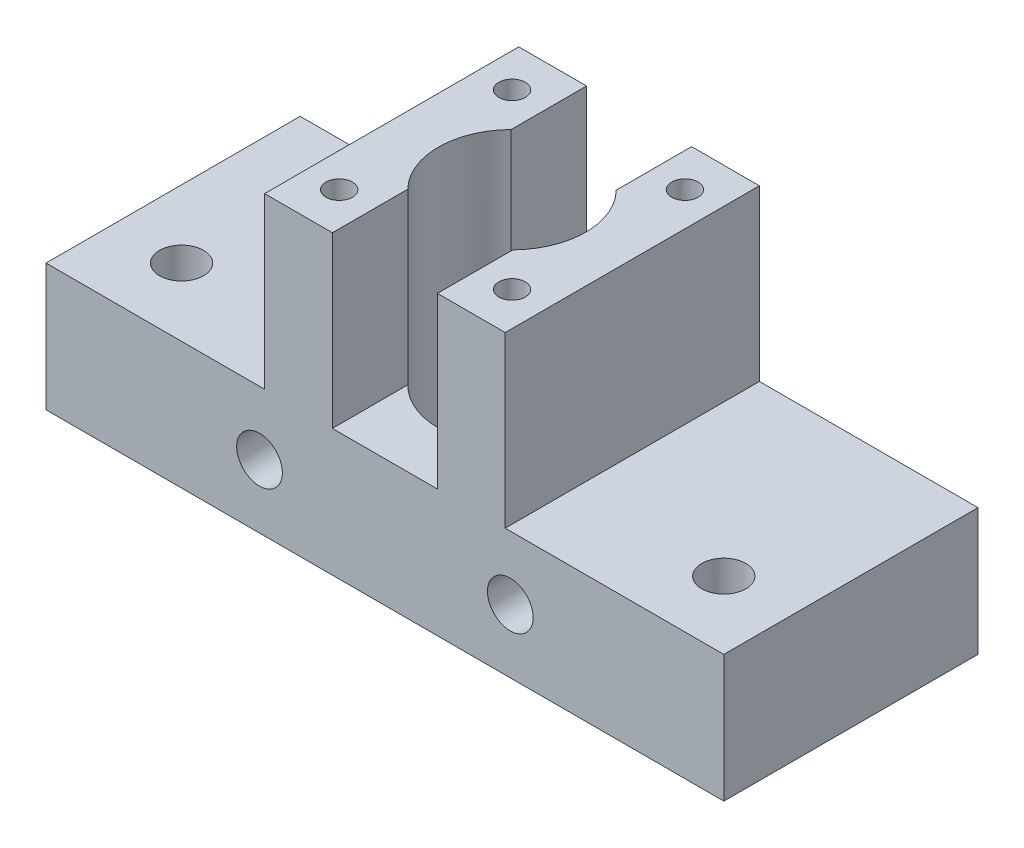
from build123d import *

# Parameters (mm, degrees)
SKETCH3_W               = 101.6
SKETCH3_H               = 38.1
BOSS_EXTRUDE2_DEPTH     = 19.05
BOSS_EXTRUDE4_START     = 24.868285686
BOSS_EXTRUDE4_OUTLINE_W = 36.068
BOSS_EXTRUDE4_OUTLINE_H = 25.4
BOSS_EXTRUDE4_DEPTH     = 38.1
CUT_EXTRUDE2_REACH      = 111.036
SKETCH7_R               = 11.049
SKETCH7_R_2             = 1.9812
SKETCH8_W               = 15.748
SKETCH8_H               = 38.1
CUT_EXTRUDE3_DEPTH      = 25.4
CUT_EXTRUDE4_REACH      = 111.036
SKETCH9_R               = 3.302
CUT_EXTRUDE5_REACH      = 98.827
SKETCH11_R              = 3.429


# Read off the part's stored shape, not the designer's step: Boss-Extrude4
with BuildPart() as part:
    # Sketch3 → Boss-Extrude2 (new body)
    with BuildSketch(Plane(origin=(0, 0, 0), x_dir=(1, 0, 0), z_dir=(0, 1, 0))):
        with Locations((-26.323326811, -43.918285686)):
            Rectangle(SKETCH3_W, SKETCH3_H)
    extrude(amount=BOSS_EXTRUDE2_DEPTH)

    # Boss-Extrude4 outline → Boss-Extrude4 (add)
    with BuildSketch(Plane.XY.offset(BOSS_EXTRUDE4_START)):
        with Locations((-26.323326811, 31.75)):
            Rectangle(BOSS_EXTRUDE4_OUTLINE_W, BOSS_EXTRUDE4_OUTLINE_H)
    extrude(amount=BOSS_EXTRUDE4_DEPTH)

    # Sketch7 → Cut-Extrude2 (cut, up to next)
    with BuildSketch(Plane(origin=(0, 44.45, 0), x_dir=(1, 0, 0), z_dir=(0, 1, 0)), mode=Mode.PRIVATE) as cut_extrude2_sk1:
        with Locations(Location((-26.323326811, -43.918285686, 0), (0, 0, 270))):
            Circle(SKETCH7_R)
    cut_extrude2_tool1 = extrude(cut_extrude2_sk1.sketch, amount=-CUT_EXTRUDE2_REACH, mode=Mode.PRIVATE) & part.part
    # Sketch7 → Cut-Extrude2 (cut, up to next)
    with BuildSketch(Plane(origin=(0, 44.45, 0), x_dir=(1, 0, 0), z_dir=(0, 1, 0)), mode=Mode.PRIVATE) as cut_extrude2_sk2:
        with Locations(Location((-13.369326811, -56.863342795, 0), (0, 0, 270))):
            Circle(SKETCH7_R_2)
    cut_extrude2_tool2 = extrude(cut_extrude2_sk2.sketch, amount=-CUT_EXTRUDE2_REACH, mode=Mode.PRIVATE) & part.part
    # Sketch7 → Cut-Extrude2 (cut, up to next)
    with BuildSketch(Plane(origin=(0, 44.45, 0), x_dir=(1, 0, 0), z_dir=(0, 1, 0)), mode=Mode.PRIVATE) as cut_extrude2_sk3:
        with Locations(Location((-39.277326811, -56.863342795, 0), (0, 0, 270))):
            Circle(SKETCH7_R_2)
    cut_extrude2_tool3 = extrude(cut_extrude2_sk3.sketch, amount=-CUT_EXTRUDE2_REACH, mode=Mode.PRIVATE) & part.part
    # Sketch7 → Cut-Extrude2 (cut, up to next)
    with BuildSketch(Plane(origin=(0, 44.45, 0), x_dir=(1, 0, 0), z_dir=(0, 1, 0)), mode=Mode.PRIVATE) as cut_extrude2_sk4:
        with Locations(Location((-39.277326811, -30.955342795, 0), (0, 0, 270))):
            Circle(SKETCH7_R_2)
    cut_extrude2_tool4 = extrude(cut_extrude2_sk4.sketch, amount=-CUT_EXTRUDE2_REACH, mode=Mode.PRIVATE) & part.part
    # Sketch7 → Cut-Extrude2 (cut, up to next)
    with BuildSketch(Plane(origin=(0, 44.45, 0), x_dir=(1, 0, 0), z_dir=(0, 1, 0)), mode=Mode.PRIVATE) as cut_extrude2_sk5:
        with Locations(Location((-13.369326811, -30.955342795, 0), (0, 0, 270))):
            Circle(SKETCH7_R_2)
    cut_extrude2_tool5 = extrude(cut_extrude2_sk5.sketch, amount=-CUT_EXTRUDE2_REACH, mode=Mode.PRIVATE) & part.part
    add(cut_extrude2_tool1.solids().sort_by_distance((-26.323327, 44.45, 43.918286))[0], mode=Mode.SUBTRACT)
    add(cut_extrude2_tool2.solids().sort_by_distance((-13.369327, 44.45, 56.863343))[0], mode=Mode.SUBTRACT)
    add(cut_extrude2_tool3.solids().sort_by_distance((-39.277327, 44.45, 56.863343))[0], mode=Mode.SUBTRACT)
    add(cut_extrude2_tool4.solids().sort_by_distance((-39.277327, 44.45, 30.955343))[0], mode=Mode.SUBTRACT)
    add(cut_extrude2_tool5.solids().sort_by_distance((-13.369327, 44.45, 30.955343))[0], mode=Mode.SUBTRACT)

    # Sketch8 → Cut-Extrude3 (cut)
    with BuildSketch(Plane(origin=(0, 44.45, 0), x_dir=(1, 0, 0), z_dir=(0, 1, 0))):
        with Locations((-26.323326811, -43.918285686)):
            Rectangle(SKETCH8_W, SKETCH8_H)
    extrude(amount=-CUT_EXTRUDE3_DEPTH, mode=Mode.SUBTRACT)

    # Sketch9 → Cut-Extrude4 (cut, up to next)
    with BuildSketch(Plane.XZ, mode=Mode.PRIVATE) as cut_extrude4_sk1:
        with Locations(Location((14.316673189, 52.808285686, 0), (0, 0, 270))):
            Circle(SKETCH9_R)
    cut_extrude4_tool1 = extrude(cut_extrude4_sk1.sketch, amount=-CUT_EXTRUDE4_REACH, mode=Mode.PRIVATE) & part.part
    # Sketch9 → Cut-Extrude4 (cut, up to next)
    with BuildSketch(Plane.XZ, mode=Mode.PRIVATE) as cut_extrude4_sk2:
        with Locations(Location((-66.963326811, 52.808285686, 0), (0, 0, 270))):
            Circle(SKETCH9_R)
    cut_extrude4_tool2 = extrude(cut_extrude4_sk2.sketch, amount=-CUT_EXTRUDE4_REACH, mode=Mode.PRIVATE) & part.part
    add(cut_extrude4_tool1.solids().sort_by_distance((14.316673, 0, 52.808286))[0], mode=Mode.SUBTRACT)
    add(cut_extrude4_tool2.solids().sort_by_distance((-66.963327, 0, 52.808286))[0], mode=Mode.SUBTRACT)

    # Sketch11 → Cut-Extrude5 (cut, up to next)
    with BuildSketch(Plane(origin=(0, 0, 24.868285686), x_dir=(-1, 0, 0), z_dir=(0, 0, -1)), mode=Mode.PRIVATE) as cut_extrude5_sk1:
        with Locations((7.527326811, 9.525)):
            Circle(SKETCH11_R)
    cut_extrude5_tool1 = extrude(cut_extrude5_sk1.sketch, amount=-CUT_EXTRUDE5_REACH, mode=Mode.PRIVATE) & part.part
    # Sketch11 → Cut-Extrude5 (cut, up to next)
    with BuildSketch(Plane(origin=(0, 0, 24.868285686), x_dir=(-1, 0, 0), z_dir=(0, 0, -1)), mode=Mode.PRIVATE) as cut_extrude5_sk2:
        with Locations((45.119326811, 9.525)):
            Circle(SKETCH11_R)
    cut_extrude5_tool2 = extrude(cut_extrude5_sk2.sketch, amount=-CUT_EXTRUDE5_REACH, mode=Mode.PRIVATE) & part.part
    add(cut_extrude5_tool1.solids().sort_by_distance((-7.527327, 9.525, 24.868286))[0], mode=Mode.SUBTRACT)
    add(cut_extrude5_tool2.solids().sort_by_distance((-45.119327, 9.525, 24.868286))[0], mode=Mode.SUBTRACT)


solid = part.part
